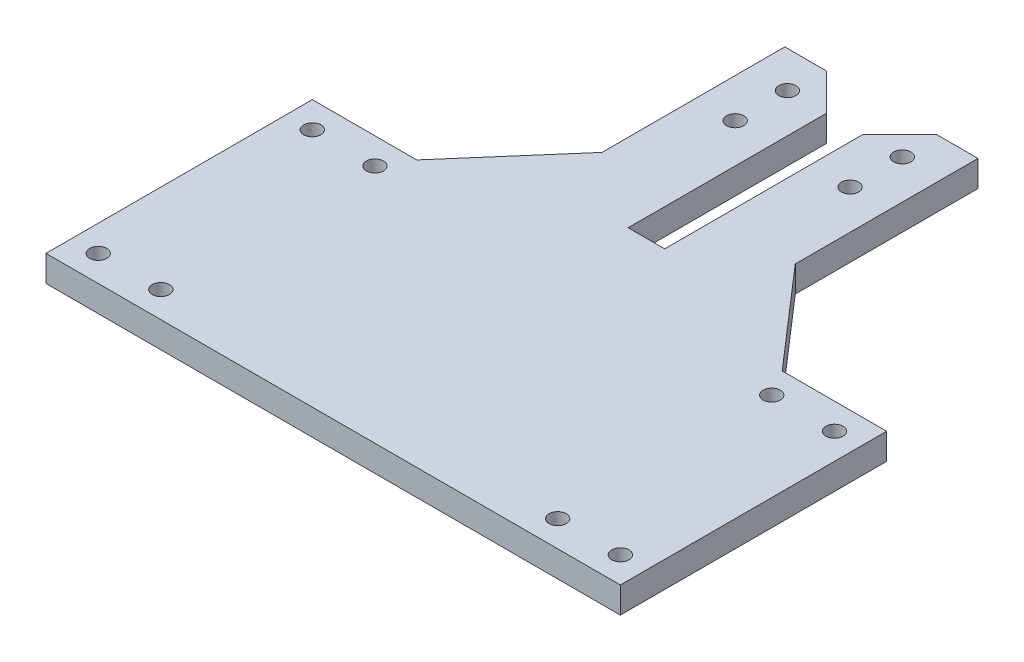
from build123d import *

# Parameters (mm, degrees)
BOSS_EXTRUDE1_DEPTH = 5
SKETCH2_R           = 1.65
CUT_EXTRUDE1_DEPTH  = 5
SKETCH3_R           = 1.65
CUT_EXTRUDE2_DEPTH  = 19
CHAMFER1_SIZE       = 7
SKETCH4_R           = 3.15
CUT_EXTRUDE4_DEPTH  = 2


# Read off the part's stored shape, not the designer's step: Boss-Extrude1
with BuildPart() as part:
    # Boss-Extrude1 outline → Boss-Extrude1 (new body)
    with BuildSketch(Plane(origin=(0, 0, 0), x_dir=(1, 0, 0), z_dir=(0, 1, 0))):
        Polygon((18.5, 105), (3.5, 105), (3.5, 60), (-3.5, 60), (-3.5, 105), (-18.5, 105), (-18.5, 70), (-35, 51), (-55, 51), (-55, 0), (55, 0), (55, 51), (35, 51), (18.5, 70), align=None)
    extrude(amount=BOSS_EXTRUDE1_DEPTH)

    # Sketch2 → Cut-Extrude1 (cut)
    with BuildSketch(Plane(origin=(0, 0, 0), x_dir=(1, 0, 0), z_dir=(0, 1, 0))):
        with Locations(Location((-50, 5, 0), (0, 0, 90))):
            Circle(SKETCH2_R)
        with Locations(Location((-38, 5, 0), (0, 0, 90))):
            Circle(SKETCH2_R)
        with Locations(Location((50, 5, 0), (0, 0, 90))):
            Circle(SKETCH2_R)
        with Locations(Location((38, 5, 0), (0, 0, 90))):
            Circle(SKETCH2_R)
        with Locations(Location((-50, 46, 0), (0, 0, 90))):
            Circle(SKETCH2_R)
        with Locations(Location((-38, 46, 0), (0, 0, 90))):
            Circle(SKETCH2_R)
        with Locations(Location((50, 46, 0), (0, 0, 90))):
            Circle(SKETCH2_R)
        with Locations(Location((38, 46, 0), (0, 0, 90))):
            Circle(SKETCH2_R)
    extrude(amount=CUT_EXTRUDE1_DEPTH, mode=Mode.SUBTRACT)

    # Sketch3 → Cut-Extrude2 (cut)
    with BuildSketch(Plane(origin=(0, 0, 0), x_dir=(1, 0, 0), z_dir=(0, 1, 0))):
        with Locations(Location((-11, 88, 0), (0, 0, 90))):
            Circle(SKETCH3_R)
        with Locations(Location((11, 88, 0), (0, 0, 90))):
            Circle(SKETCH3_R)
        with Locations(Location((11, 98, 0), (0, 0, 90))):
            Circle(SKETCH3_R)
        with Locations(Location((-11, 98, 0), (0, 0, 90))):
            Circle(SKETCH3_R)
    extrude(amount=CUT_EXTRUDE2_DEPTH, mode=Mode.SUBTRACT)

    # Chamfer1
    chamfer1_edges = [part.edges().sort_by_distance(p)[0] for p in [
        (-3.5, 2.5, -105),
        (3.5, 2.5, -105),
    ]]
    chamfer(chamfer1_edges, length=CHAMFER1_SIZE)

    # Sketch4 → Cut-Extrude4 (cut)
    with BuildSketch(Plane(origin=(0, 0, 0), x_dir=(1, 0, 0), z_dir=(0, 1, 0))):
        with Locations(Location((-11, 98, 0), (0, 0, 270))):
            Circle(SKETCH4_R)
        with Locations(Location((11, 98, 0), (0, 0, 270))):
            Circle(SKETCH4_R)
        with Locations(Location((-11, 88, 0), (0, 0, 270))):
            Circle(SKETCH4_R)
        with Locations(Location((11, 88, 0), (0, 0, 270))):
            Circle(SKETCH4_R)
        with Locations(Location((-50, 46, 0), (0, 0, 270))):
            Circle(SKETCH4_R)
        with Locations(Location((-38, 46, 0), (0, 0, 270))):
            Circle(SKETCH4_R)
        with Locations(Location((38, 46, 0), (0, 0, 270))):
            Circle(SKETCH4_R)
        with Locations(Location((50, 46, 0), (0, 0, 270))):
            Circle(SKETCH4_R)
        with Locations(Location((38, 5, 0), (0, 0, 270))):
            Circle(SKETCH4_R)
        with Locations(Location((50, 5, 0), (0, 0, 270))):
            Circle(SKETCH4_R)
        with Locations(Location((-50, 5, 0), (0, 0, 270))):
            Circle(SKETCH4_R)
        with Locations(Location((-38, 5, 0), (0, 0, 270))):
            Circle(SKETCH4_R)
    extrude(amount=CUT_EXTRUDE4_DEPTH, mode=Mode.SUBTRACT)


solid = part.part
